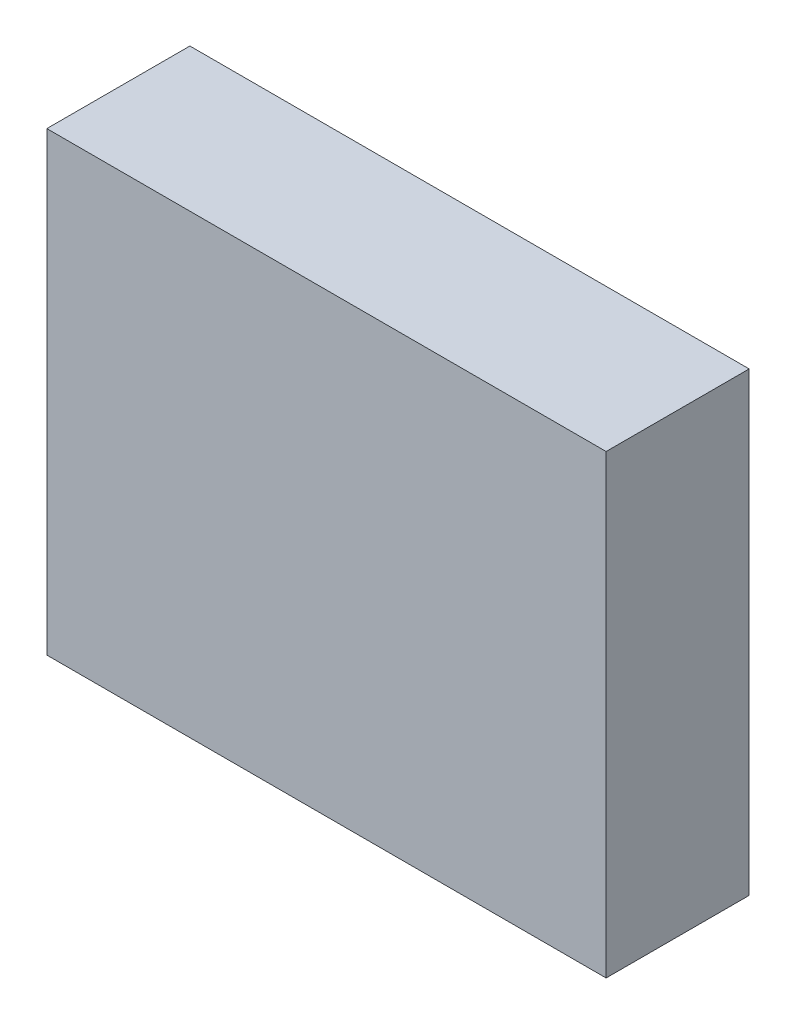
from build123d import *

# Parameters (mm, degrees)
ESBO_O1_W                = 156.39786889
ESBO_O1_H                = 127.51
RESSALTO_EXTRUS_O1_DEPTH = 40


with BuildPart() as part:
    # Esboço1 → Ressalto-extrusão1 (new body)
    with BuildSketch(Plane.XY):
        Rectangle(ESBO_O1_W, ESBO_O1_H)
    extrude(amount=RESSALTO_EXTRUS_O1_DEPTH)


solid = part.part
